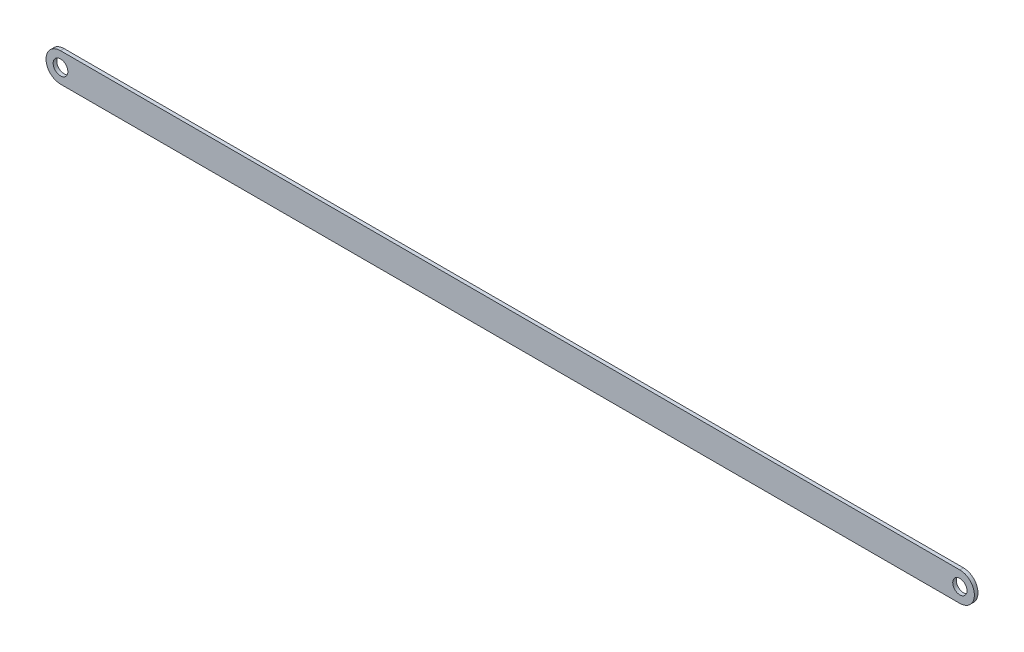
from build123d import *

# Parameters (mm, degrees)
SKETCH1_R           = 6.430069769
SKETCH1_R_2         = 6.247756724
BOSS_EXTRUDE1_DEPTH = 3.175


with BuildPart() as part:
    # Sketch1 → Boss-Extrude1 (new body)
    with BuildSketch(Plane.XY):
        with BuildLine():
            Line((787.4, 12.7), (0, 12.7))
            ThreePointArc((0, 12.7), (-12.7, 0), (0, -12.7))
            Line((0, -12.7), (787.4, -12.7))
            ThreePointArc((787.4, -12.7), (800.1, 0), (787.4, 12.7))
        make_face()
        Circle(SKETCH1_R, mode=Mode.SUBTRACT)
        with Locations((787.4, 0)):
            Circle(SKETCH1_R_2, mode=Mode.SUBTRACT)
    extrude(amount=BOSS_EXTRUDE1_DEPTH)


solid = part.part
